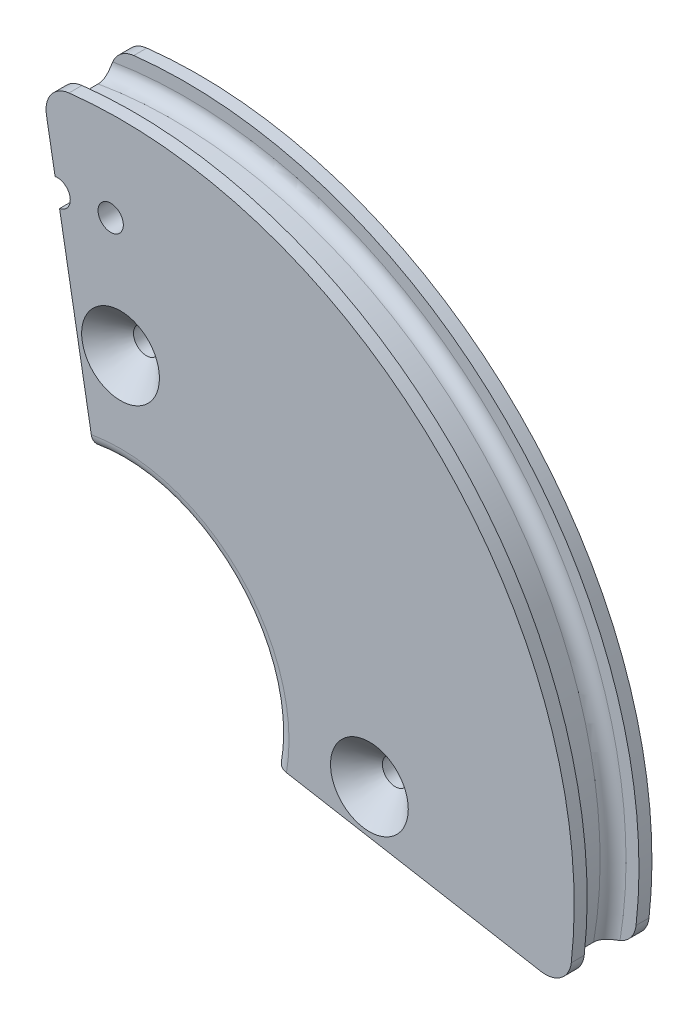
from build123d import *

# Parameters (mm, degrees)
SKETCH1_R               = 17
SKETCH1_R_2             = 0.49999999999999895
SKETCH1_R_3             = 6
SKETCH1_R_4             = 0.4999999999999985
SKETCH1_R_5             = 0.49999999999999967
SKETCH1_R_6             = 0.5000000000000008
BOSS_EXTRUDE1_DEPTH     = 1.5
SKETCH7_W               = 0.5
SKETCH7_H               = 0.5
CUT_EXTRUDE1_DEPTH      = 25.794152536434876
CUT_EXTRUDE1_DEPTH_BACK = 25.794152536434876
CUT_EXTRUDE2_DEPTH      = 25.92990172463582
CUT_EXTRUDE2_DEPTH_BACK = 25.92990172463582
SKETCH5_R               = 0.5000000000000009
SKETCH5_R_2             = 0.48729793970449836
FILLET1_R               = 0.5
CHAMFER1_SIZE           = 1
FILLET2_R               = 1


with BuildPart() as part:
    # Sketch1 → Boss-Extrude1 (new, symmetric)
    with BuildSketch(Plane.XY):
        Circle(SKETCH1_R)
        with Locations((9.600000000000001, 0)):
            Circle(SKETCH1_R_2, mode=Mode.SUBTRACT)
        Circle(SKETCH1_R_3, mode=Mode.SUBTRACT)
        with Locations((-3.352e-14, -9.600000000000001)):
            Circle(SKETCH1_R_4, mode=Mode.SUBTRACT)
        with Locations((-9.600000000000001, 6.704e-14)):
            Circle(SKETCH1_R_5, mode=Mode.SUBTRACT)
        with Locations((1.0055e-13, 9.600000000000001)):
            Circle(SKETCH1_R_6, mode=Mode.SUBTRACT)
    extrude(amount=BOSS_EXTRUDE1_DEPTH, both=True)

    # Sketch2 → Cut-Revolve1 (revolve, cut)
    with BuildSketch(Plane(origin=(0, 0, 0), x_dir=(1, 0, 0), z_dir=(0, 1, 0)), mode=Mode.PRIVATE) as cut_revolve1_sk:
        with BuildLine():
            Line((-16.5, -0.49999999999999956), (-16.5, 0.49999999999999956))
            ThreePointArc((-16.5, 0.49999999999999956), (-16.646446609406727, 0.8535533905932733), (-17, 1))
            Line((-17, 1), (-17, -1))
            ThreePointArc((-17, -1), (-16.646446609406727, -0.8535533905932733), (-16.5, -0.49999999999999956))
        make_face()
    revolve(cut_revolve1_sk.sketch.rotate(Axis((0, 0, 0), (0, 0, -1)), 180), axis=Axis((0, 0, 0), (0, 0, -1)), mode=Mode.SUBTRACT)

    # Sketch7 → Revolve1 (revolve)
    with BuildSketch(Plane(origin=(0, 0, 0), x_dir=(1, 0, 0), z_dir=(0, 1, 0))):
        with Locations((17.25, 1.25)):
            Rectangle(SKETCH7_W, SKETCH7_H)
        with Locations((17.25, -1.25)):
            Rectangle(SKETCH7_W, SKETCH7_H)
    revolve(axis=Axis((0, 0, 0), (0, 0, -1)))

    # Sketch4 → Cut-Extrude1 (cut, two sides: drawn at the far end of the back side and taken through both)
    with BuildSketch(Plane.XY.offset(-CUT_EXTRUDE1_DEPTH_BACK)):
        Polygon((-3.3089929101566358, 18.76623133261556), (0, 0), (18.766231332615533, -3.308992910156828), (18.766231332615533, -21.784688156780618), (-24.932091474912426, -21.784688156780618), (-24.93209147491243, 18.76623133261556), align=None)
    extrude(amount=CUT_EXTRUDE1_DEPTH + CUT_EXTRUDE1_DEPTH_BACK, mode=Mode.SUBTRACT)

    # Sketch5 → Cut-Extrude2 (cut, two sides: drawn at the far end of the back side and taken through both)
    with BuildSketch(Plane.XY.offset(1.5).offset(-CUT_EXTRUDE2_DEPTH_BACK)):
        with Locations((-2.439480379102094, 13.834980723316052)):
            Circle(SKETCH5_R)
        with Locations((-0.37984462011943565, 14.021287153916445)):
            Circle(SKETCH5_R_2)
    extrude(amount=CUT_EXTRUDE2_DEPTH + CUT_EXTRUDE2_DEPTH_BACK, mode=Mode.SUBTRACT)

    # Fillet1
    fillet1_edges = [part.edges().sort_by_distance(p)[0] for p in [
        (4.242640687119308, 4.242640687119264, 1.5),
        (4.242640687119308, 4.242640687119264, -1.5),
    ]]
    fillet(fillet1_edges, radius=FILLET1_R)

    # Chamfer1
    chamfer1_edges = [part.edges().sort_by_distance(p)[0] for p in [
        (9.100000000000003, 6e-17, 1.5),
        (-0.49999999999990025, 9.600000000000001, 1.5),
    ]]
    chamfer(chamfer1_edges, length=CHAMFER1_SIZE)

    # Fillet2
    fillet2_edges = [part.edges().sort_by_distance(p)[0] for p in [
        (17.23413567771362, -3.0388431091714043, 1.25),
        (-3.0388431091712285, 17.23413567771365, -1.25),
    ]]
    fillet(fillet2_edges, radius=FILLET2_R - 0.0001)  # a hair under: the kernel refuses the full size


solid = part.part
